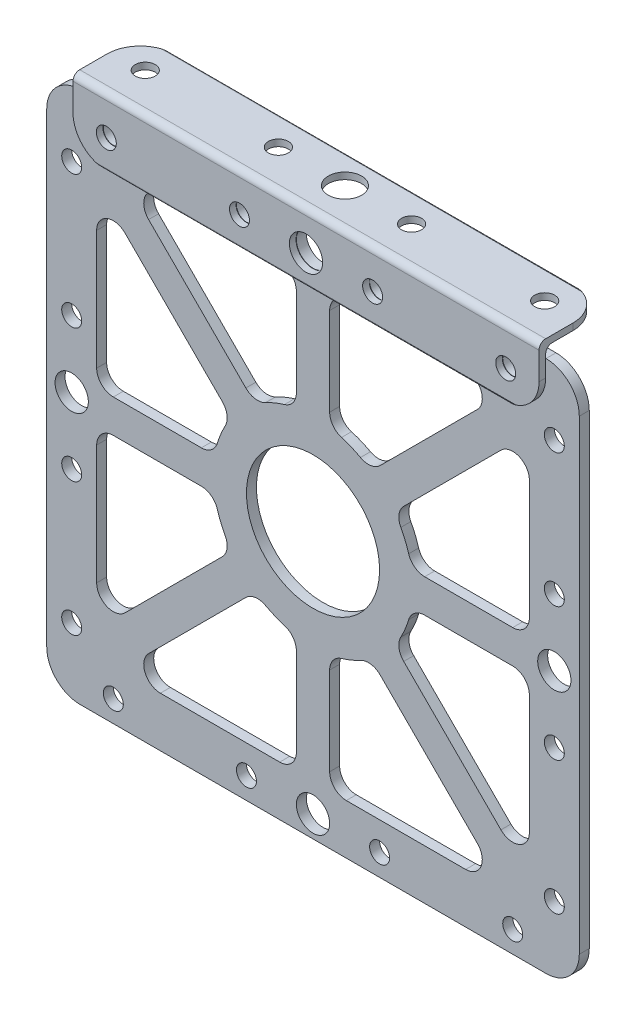
from build123d import *

# Parameters (mm, degrees)
SALIENTE_EXTRUIR1_DEPTH    = 1.5
CROQUIS2_R                 = 10
CORTAR_EXTRUIR1_DEPTH      = 57.588426379
CROQUIS3_R                 = 1.5
CROQUIS3_R_2               = 2.5
CORTAR_EXTRUIR2_DEPTH      = 57.588426379
SALIENTE_EXTRUIR2_DEPTH    = 35
CORTAR_EXTRUIR3_DEPTH      = 58.587542056
CORTAR_EXTRUIR3_DEPTH_BACK = 58.587542056
CROQUIS4_R                 = 1.5
CROQUIS4_R_2               = 2.5
REDONDEO1_START            = -2
REDONDEO1_DEPTH            = 6
MATRIZC1_COUNT             = 2
MATRIZC1_ANGLE             = 90
SALIENTE_EXTRUIR3_DEPTH    = 70
CORTAR_EXTRUIR4_DEPTH      = 87.583846704


with BuildPart() as part:
    # Croquis1 → Saliente-Extruir1 (new body)
    with BuildSketch(Plane.XY):
        with BuildLine():
            Line((-35, -40), (35, -40))
            ThreePointArc((35, -40), (38.535533906, -38.535533906), (40, -35))
            Line((40, -35), (40, 35))
            ThreePointArc((40, 35), (38.535533906, 38.535533906), (35, 40))
            Line((35, 40), (-35, 40))
            ThreePointArc((-35, 40), (-38.535533906, 38.535533906), (-40, 35))
            Line((-40, 35), (-40, -35))
            ThreePointArc((-40, -35), (-38.535533906, -38.535533906), (-35, -40))
        make_face()
    extrude(amount=SALIENTE_EXTRUIR1_DEPTH)

    # Croquis2 → Cortar-Extruir1 (cut, through all)
    with BuildSketch(Plane.XY.offset(1.5)):
        Circle(CROQUIS2_R)
        with BuildLine():
            Line((2.5, 16.770509831), (2.5, 30))
            ThreePointArc((2.5, 30), (3.232233047, 31.767766953), (5, 32.5))
            Line((5, 32.5), (22.928932188, 32.5))
            ThreePointArc((22.928932188, 32.5), (25.238631019, 30.956708581), (24.696699141, 28.232233047))
            Line((24.696699141, 28.232233047), (10.090774273, 13.626308179))
            ThreePointArc((10.090774273, 13.626308179), (8.683931275, 12.920265539), (7.134006274, 13.194921541))
            ThreePointArc((7.134006274, 13.194921541), (5.740251485, 13.858192988), (4.285714286, 14.374722712))
            ThreePointArc((4.285714286, 14.374722712), (2.995540686, 15.27647407), (2.5, 16.770509831))
        make_face()
        with BuildLine():
            Line((-10.090774273, 13.626308179), (-24.696699141, 28.232233047))
            ThreePointArc((-24.696699141, 28.232233047), (-25.238631019, 30.956708581), (-22.928932188, 32.5))
            Line((-22.928932188, 32.5), (-5, 32.5))
            ThreePointArc((-5, 32.5), (-3.232233047, 31.767766953), (-2.5, 30))
            Line((-2.5, 30), (-2.5, 16.770509831))
            ThreePointArc((-2.5, 16.770509831), (-2.995540686, 15.27647407), (-4.285714286, 14.374722712))
            ThreePointArc((-4.285714286, 14.374722712), (-5.740251485, 13.858192988), (-7.134006274, 13.194921541))
            ThreePointArc((-7.134006274, 13.194921541), (-8.683931275, 12.920265539), (-10.090774273, 13.626308179))
        make_face()
        with BuildLine():
            Line((32.5, 5), (32.5, 22.928932188))
            ThreePointArc((32.5, 22.928932188), (30.956708581, 25.238631019), (28.232233047, 24.696699141))
            Line((28.232233047, 24.696699141), (13.626308179, 10.090774273))
            ThreePointArc((13.626308179, 10.090774273), (12.920265539, 8.683931275), (13.194921541, 7.134006274))
            ThreePointArc((13.194921541, 7.134006274), (13.858192988, 5.740251485), (14.374722712, 4.285714286))
            ThreePointArc((14.374722712, 4.285714286), (15.27647407, 2.995540686), (16.770509831, 2.5))
            Line((16.770509831, 2.5), (30, 2.5))
            ThreePointArc((30, 2.5), (31.767766953, 3.232233047), (32.5, 5))
        make_face()
        with BuildLine():
            Line((16.770509831, -2.5), (30, -2.5))
            ThreePointArc((30, -2.5), (31.767766953, -3.232233047), (32.5, -5))
            Line((32.5, -5), (32.5, -22.928932188))
            ThreePointArc((32.5, -22.928932188), (30.956708581, -25.238631019), (28.232233047, -24.696699141))
            Line((28.232233047, -24.696699141), (13.626308179, -10.090774273))
            ThreePointArc((13.626308179, -10.090774273), (12.920265539, -8.683931275), (13.194921541, -7.134006274))
            ThreePointArc((13.194921541, -7.134006274), (13.858192988, -5.740251485), (14.374722712, -4.285714286))
            ThreePointArc((14.374722712, -4.285714286), (15.27647407, -2.995540686), (16.770509831, -2.5))
        make_face()
        with BuildLine():
            Line((5, -32.5), (22.928932188, -32.5))
            ThreePointArc((22.928932188, -32.5), (25.238631019, -30.956708581), (24.696699141, -28.232233047))
            Line((24.696699141, -28.232233047), (10.090774273, -13.626308179))
            ThreePointArc((10.090774273, -13.626308179), (8.683931275, -12.920265539), (7.134006274, -13.194921541))
            ThreePointArc((7.134006274, -13.194921541), (5.740251485, -13.858192988), (4.285714286, -14.374722712))
            ThreePointArc((4.285714286, -14.374722712), (2.995540686, -15.27647407), (2.5, -16.770509831))
            Line((2.5, -16.770509831), (2.5, -30))
            ThreePointArc((2.5, -30), (3.232233047, -31.767766953), (5, -32.5))
        make_face()
        with BuildLine():
            Line((-2.5, -16.770509831), (-2.5, -30))
            ThreePointArc((-2.5, -30), (-3.232233047, -31.767766953), (-5, -32.5))
            Line((-5, -32.5), (-22.928932188, -32.5))
            ThreePointArc((-22.928932188, -32.5), (-25.238631019, -30.956708581), (-24.696699141, -28.232233047))
            Line((-24.696699141, -28.232233047), (-10.090774273, -13.626308179))
            ThreePointArc((-10.090774273, -13.626308179), (-8.683931275, -12.920265539), (-7.134006274, -13.194921541))
            ThreePointArc((-7.134006274, -13.194921541), (-5.740251485, -13.858192988), (-4.285714286, -14.374722712))
            ThreePointArc((-4.285714286, -14.374722712), (-2.995540686, -15.27647407), (-2.5, -16.770509831))
        make_face()
        with BuildLine():
            Line((-32.5, -5), (-32.5, -22.928932188))
            ThreePointArc((-32.5, -22.928932188), (-30.956708581, -25.238631019), (-28.232233047, -24.696699141))
            Line((-28.232233047, -24.696699141), (-13.626308179, -10.090774273))
            ThreePointArc((-13.626308179, -10.090774273), (-12.920265539, -8.683931275), (-13.194921541, -7.134006274))
            ThreePointArc((-13.194921541, -7.134006274), (-13.858192988, -5.740251485), (-14.374722712, -4.285714286))
            ThreePointArc((-14.374722712, -4.285714286), (-15.27647407, -2.995540686), (-16.770509831, -2.5))
            Line((-16.770509831, -2.5), (-30, -2.5))
            ThreePointArc((-30, -2.5), (-31.767766953, -3.232233047), (-32.5, -5))
        make_face()
        with BuildLine():
            Line((-16.770509831, 2.5), (-30, 2.5))
            ThreePointArc((-30, 2.5), (-31.767766953, 3.232233047), (-32.5, 5))
            Line((-32.5, 5), (-32.5, 22.928932188))
            ThreePointArc((-32.5, 22.928932188), (-30.956708581, 25.238631019), (-28.232233047, 24.696699141))
            Line((-28.232233047, 24.696699141), (-13.626308179, 10.090774273))
            ThreePointArc((-13.626308179, 10.090774273), (-12.920265539, 8.683931275), (-13.194921541, 7.134006274))
            ThreePointArc((-13.194921541, 7.134006274), (-13.858192988, 5.740251485), (-14.374722712, 4.285714286))
            ThreePointArc((-14.374722712, 4.285714286), (-15.27647407, 2.995540686), (-16.770509831, 2.5))
        make_face()
    extrude(amount=-CORTAR_EXTRUIR1_DEPTH, mode=Mode.SUBTRACT)

    # Croquis3 → Cortar-Extruir2 (cut, through all)
    with BuildSketch(Plane.XY.offset(1.5)):
        with Locations((-36.25, 30)):
            Circle(CROQUIS3_R)
        with Locations((-36.25, 10)):
            Circle(CROQUIS3_R)
        with Locations((-36.25, -10)):
            Circle(CROQUIS3_R)
        with Locations((-36.25, -30)):
            Circle(CROQUIS3_R)
        with Locations(Location((36.25, -30, 0), (0, 0, 180))):
            Circle(CROQUIS3_R)
        with Locations(Location((36.25, -10, 0), (0, 0, 180))):
            Circle(CROQUIS3_R)
        with Locations(Location((36.25, 10, 0), (0, 0, 180))):
            Circle(CROQUIS3_R)
        with Locations(Location((36.25, 30, 0), (0, 0, 180))):
            Circle(CROQUIS3_R)
        with Locations((-36.25, 0)):
            Circle(CROQUIS3_R_2)
        with Locations(Location((36.25, 0, 0), (0, 0, 180))):
            Circle(CROQUIS3_R_2)
    extrude(amount=-CORTAR_EXTRUIR2_DEPTH, mode=Mode.SUBTRACT)


with BuildPart() as body_2:
    # Croquis5 → Saliente-Extruir2 (new, symmetric)
    with BuildSketch(Plane(origin=(0, 0, 0), x_dir=(0, 0, -1), z_dir=(1, 0, 0))):
        with BuildLine():
            Line((-1.55, 32.75), (-1.55, 40))
            ThreePointArc((-1.55, 40), (-1.476776695, 40.176776695), (-1.3, 40.25))
            Line((-1.3, 40.25), (-0.2, 40.25))
            ThreePointArc((-0.2, 40.25), (-0.023223305, 40.176776695), (0.05, 40))
            Line((0.05, 40), (0.05, 32.75))
            ThreePointArc((0.05, 32.75), (0.123223305, 32.573223305), (0.3, 32.5))
            Line((0.3, 32.5), (0.8, 32.5))
            ThreePointArc((0.8, 32.5), (0.976776695, 32.573223305), (1.05, 32.75))
            Line((1.05, 32.75), (1.05, 40.85))
            ThreePointArc((1.05, 40.85), (0.903553391, 41.203553391), (0.55, 41.35))
            Line((0.55, 41.35), (-2.05, 41.35))
            ThreePointArc((-2.05, 41.35), (-2.403553391, 41.203553391), (-2.55, 40.85))
            Line((-2.55, 40.85), (-2.55, 32.75))
            ThreePointArc((-2.55, 32.75), (-2.476776695, 32.573223305), (-2.3, 32.5))
            Line((-2.3, 32.5), (-1.8, 32.5))
            ThreePointArc((-1.8, 32.5), (-1.623223305, 32.573223305), (-1.55, 32.75))
        make_face()
    extrude(amount=SALIENTE_EXTRUIR2_DEPTH, both=True)


with BuildPart() as cortar_extruir3_tool:
    # Croquis4 → Cortar-Extruir3 (new, two sides: drawn at the far end of the back side and taken through both)
    with BuildSketch(Plane.XY.offset(1.5).offset(-CORTAR_EXTRUIR3_DEPTH_BACK)):
        with Locations(Location((-30, 36.75, 0), (0, 0, 180))):
            Circle(CROQUIS4_R)
        with Locations(Location((-10, 36.75, 0), (0, 0, 180))):
            Circle(CROQUIS4_R)
        with Locations(Location((10, 36.75, 0), (0, 0, 180))):
            Circle(CROQUIS4_R)
        with Locations(Location((30, 36.75, 0), (0, 0, 180))):
            Circle(CROQUIS4_R)
        with Locations(Location((10, -36.75, 0), (0, 0, 180))):
            Circle(CROQUIS4_R)
        with Locations(Location((30, -36.75, 0), (0, 0, 180))):
            Circle(CROQUIS4_R)
        with Locations(Location((-10, -36.75, 0), (0, 0, 180))):
            Circle(CROQUIS4_R)
        with Locations(Location((-30, -36.75, 0), (0, 0, 180))):
            Circle(CROQUIS4_R)
        with Locations(Location((0, 36.75, 0), (0, 0, 180))):
            Circle(CROQUIS4_R_2)
        with Locations(Location((0, -36.75, 0), (0, 0, 180))):
            Circle(CROQUIS4_R_2)
    extrude(amount=CORTAR_EXTRUIR3_DEPTH + CORTAR_EXTRUIR3_DEPTH_BACK)


with BuildPart() as part_1:
    add(part.part)

    # Cortar-Extruir3: cut by cortar_extruir3_tool
    add(cortar_extruir3_tool.part, mode=Mode.SUBTRACT)


with BuildPart() as body_2_1:
    add(body_2.part)

    # Cortar-Extruir3: cut by cortar_extruir3_tool
    add(cortar_extruir3_tool.part, mode=Mode.SUBTRACT)

    # Redondeo1: read off the stored shape, not the designer's step
    # Redondeo1 outline → Redondeo1 (cut)
    with BuildSketch(Plane.XY.offset(REDONDEO1_START)):
        with BuildLine():
            Line((-35, 32.5), (-30, 32.5))
            ThreePointArc((-30, 32.5), (-33.535533906, 33.964466094), (-35, 37.5))
            Line((-35, 37.5), (-35, 32.5))
        make_face()
        with BuildLine():
            ThreePointArc((35, 37.5), (33.535533906, 33.964466094), (30, 32.5))
            Line((30, 32.5), (35, 32.5))
            Line((35, 32.5), (35, 37.5))
        make_face()
    extrude(amount=REDONDEO1_DEPTH, mode=Mode.SUBTRACT)


with BuildPart() as matrizc1_1:
    # MatrizC1: pattern copy
    add(body_2_1.part.rotate(Axis((0, 40.8, 0.75), (1, 0, 0)), 1 * MATRIZC1_ANGLE / (MATRIZC1_COUNT - 1)))


with BuildPart() as body_2_2:
    add(body_2_1.part)

    # Combinar2: union MatrizC1_1
    add(matrizc1_1.part)

    # Croquis6 → Saliente-Extruir3 (add)
    with BuildSketch(Plane(origin=(35, 0, 0), x_dir=(0, 0, -1), z_dir=(1, 0, 0))):
        with BuildLine():
            Line((-2.55, 40.85), (-2.55, 41.6))
            ThreePointArc((-2.55, 41.6), (-2.257106781, 42.307106781), (-1.55, 42.6))
            Line((-1.55, 42.6), (-0.8, 42.6))
            Line((-0.8, 42.6), (-0.8, 40.85))
            Line((-0.8, 40.85), (-2.55, 40.85))
        make_face()
    extrude(amount=-SALIENTE_EXTRUIR3_DEPTH)

    # Croquis7 → Cortar-Extruir4 (cut, through all)
    with BuildSketch(Plane(origin=(35, 0, 0), x_dir=(0, 0, -1), z_dir=(1, 0, 0))):
        with BuildLine():
            Line((0.05, 37.5), (0.05, 39))
            ThreePointArc((0.05, 39), (0.342893219, 39.707106781), (1.05, 40))
            Line((1.05, 40), (2.55, 40))
            Line((2.55, 40), (2.55, 41.6))
            Line((2.55, 41.6), (-0.55, 41.6))
            ThreePointArc((-0.55, 41.6), (-1.257106781, 41.307106781), (-1.55, 40.6))
            Line((-1.55, 40.6), (-1.55, 37.5))
            Line((-1.55, 37.5), (0.05, 37.5))
        make_face()
    extrude(amount=-CORTAR_EXTRUIR4_DEPTH, mode=Mode.SUBTRACT)


with BuildPart() as cortar_extruir4_piece_1:
    # of the separate pieces the step leaves, piece 1, a body of its own (cortar_extruir4_pieces)
    add(body_2_2.part.solids().sort_by_distance((-35, 41.6, 0.55))[0])


with BuildPart() as cortar_extruir4_piece_2:
    # of the separate pieces the step leaves, piece 2, a body of its own (cortar_extruir4_pieces)
    add(body_2_2.part.solids().sort_by_distance((-35, 40, -2.55))[0])


solid = Compound([part_1.part, cortar_extruir4_piece_1.part])
